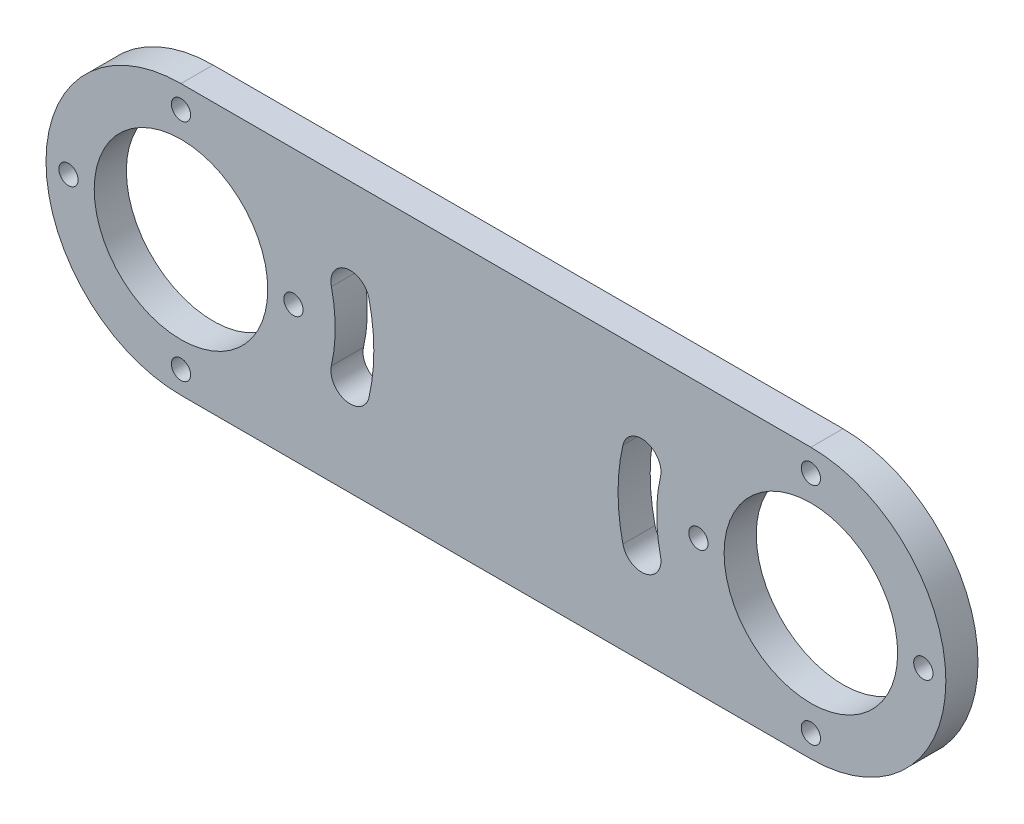
from build123d import *

# Parameters (mm, degrees)
SKETCH1_R           = 1.5
SKETCH1_R_2         = 13
BOSS_EXTRUDE1_DEPTH = 5
SKETCH2_R           = 13.5
CUT_EXTRUDE1_DEPTH  = 10
CUT_EXTRUDE2_DEPTH  = 10


with BuildPart() as part:
    # Sketch1 → Boss-Extrude1 (new body)
    with BuildSketch(Plane.XY):
        with BuildLine():
            Line((-49, 26), (49, 26))
            ThreePointArc((49, 26), (70, 5), (49, -16))
            Line((49, -16), (-49, -16))
            ThreePointArc((-49, -16), (-70, 5), (-49, 26))
        make_face()
        with Locations((49, -12.5)):
            Circle(SKETCH1_R, mode=Mode.SUBTRACT)
        with Locations((66.5, 5)):
            Circle(SKETCH1_R, mode=Mode.SUBTRACT)
        with Locations((31.5, 5)):
            Circle(SKETCH1_R, mode=Mode.SUBTRACT)
        with Locations((49, 22.5)):
            Circle(SKETCH1_R, mode=Mode.SUBTRACT)
        with Locations((-49, -12.5)):
            Circle(SKETCH1_R, mode=Mode.SUBTRACT)
        with Locations((-31.5, 5)):
            Circle(SKETCH1_R, mode=Mode.SUBTRACT)
        with Locations((-66.5, 5)):
            Circle(SKETCH1_R, mode=Mode.SUBTRACT)
        with Locations((-49, 22.5)):
            Circle(SKETCH1_R, mode=Mode.SUBTRACT)
        with Locations((-49, 5)):
            Circle(SKETCH1_R_2, mode=Mode.SUBTRACT)
        with Locations((49, 5)):
            Circle(SKETCH1_R_2, mode=Mode.SUBTRACT)
    extrude(amount=BOSS_EXTRUDE1_DEPTH)

    # Sketch2 → Cut-Extrude1 (cut)
    with BuildSketch(Plane(origin=(0, 0, 0), x_dir=(-1, 0, 0), z_dir=(0, 0, -1))):
        with Locations((-49, 5)):
            Circle(SKETCH2_R)
        with Locations((49, 5)):
            Circle(SKETCH2_R)
    extrude(amount=-CUT_EXTRUDE1_DEPTH, mode=Mode.SUBTRACT)

    # Sketch3 → Cut-Extrude2 (cut)
    with BuildSketch(Plane.XY.offset(5)):
        with BuildLine():
            ThreePointArc((25.600094967, -0.333333333), (25, 5), (25.600094967, 10.333333333))
            ThreePointArc((25.600094967, 10.333333333), (23.341773504, 13.924988129), (19.750118709, 11.666666667))
            ThreePointArc((19.750118709, 11.666666667), (19, 5), (19.750118709, -1.666666667))
            ThreePointArc((19.750118709, -1.666666667), (23.341773504, -3.924988129), (25.600094967, -0.333333333))
        make_face()
        with BuildLine():
            ThreePointArc((-25.600094967, -0.333333333), (-23.341773504, -3.924988129), (-19.750118709, -1.666666667))
            ThreePointArc((-19.750118709, -1.666666667), (-19, 5), (-19.750118709, 11.666666667))
            ThreePointArc((-19.750118709, 11.666666667), (-23.341773504, 13.924988129), (-25.600094967, 10.333333333))
            ThreePointArc((-25.600094967, 10.333333333), (-25, 5), (-25.600094967, -0.333333333))
        make_face()
    extrude(amount=-CUT_EXTRUDE2_DEPTH, mode=Mode.SUBTRACT)


solid = part.part
